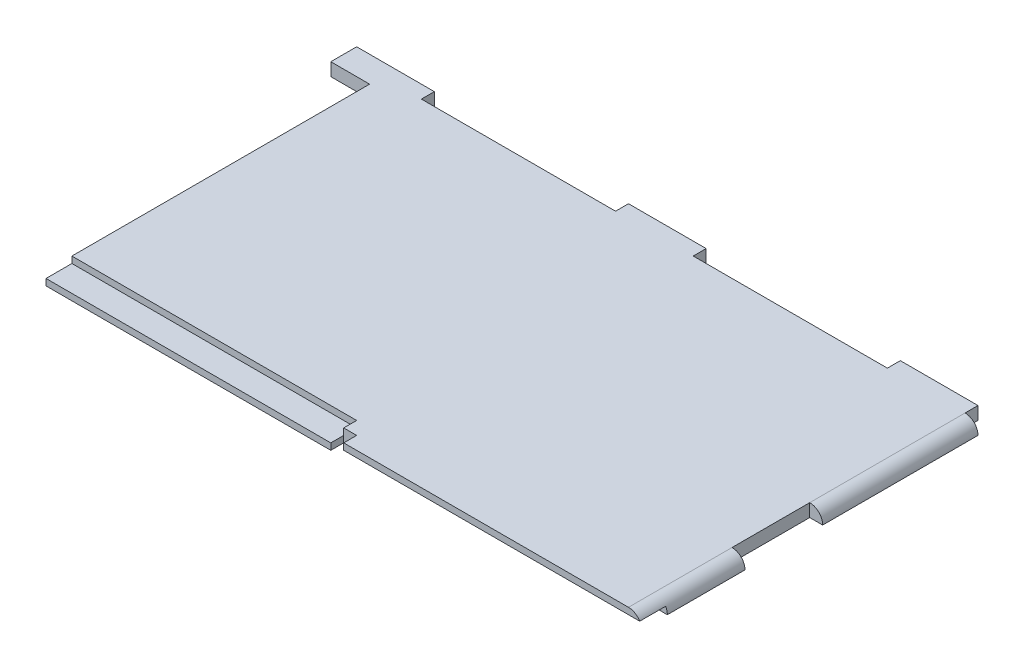
from build123d import *

# Parameters (mm, degrees)
SKETCH_1_W          = 5
SKETCH_1_H          = 60
SKETCH_1_W_2        = 30
SKETCH_1_H_2        = 5
SKETCH_1_W_3        = 15
EXTRUDE_1_DEPTH     = 5
FILLET_1_R          = 5
SKETCH_2_W          = 239.490005879
SKETCH_2_H          = 213.108485662
CUT_EXTRUDE_2_DEPTH = 10
SKETCH_3_W          = 110
SKETCH_3_H          = 2.5
SKETCH_3_W_2        = 115
CUT_EXTRUDE_3_DEPTH = 10
SKETCH_4_W          = 5
SKETCH_4_H          = 5
CUT_EXTRUDE_4_DEPTH = 5


with BuildPart() as part:
    # 草圖1 → 填料-伸長1 (new body)
    with BuildSketch(Plane(origin=(0, 0, 0), x_dir=(1, 0, 0), z_dir=(0, 1, 0))):
        Polygon((198.746286718, -286.464902661), (198.746286718, -256.464902661), (183.246286718, -256.464902661), (183.246286718, -266.464902661), (124.746286718, -266.464902661), (124.746286718, -262.464902661), (109.246286718, -262.464902661), (109.246286718, -266.464902661), (-21.253713282, -266.464902661), (-21.253713282, 38.535097339), (-36.253713282, 38.535097339), (-36.253713282, 43.535097339), (203.746286718, 43.535097339), (203.746286718, -286.464902661), align=None)
        with Locations((206.246286718, -256.464902661)):
            Rectangle(SKETCH_1_W, SKETCH_1_H)
        with Locations((206.246286718, 13.535097339)):
            Rectangle(SKETCH_1_W, SKETCH_1_H)
        with Locations((188.746286718, 46.035097339)):
            Rectangle(SKETCH_1_W_2, SKETCH_1_H_2)
        with Locations((-21.253713282, 46.035097339)):
            Rectangle(SKETCH_1_W_2, SKETCH_1_H_2)
        with Locations((91.246286718, 46.035097339)):
            Rectangle(SKETCH_1_W_3, SKETCH_1_H_2)
        with Locations((76.246286718, 46.035097339)):
            Rectangle(SKETCH_1_W_3, SKETCH_1_H_2)
        with Locations((206.246286718, -166.464902661)):
            Rectangle(SKETCH_1_W, SKETCH_1_H)
        with Locations((206.246286718, -76.464902661)):
            Rectangle(SKETCH_1_W, SKETCH_1_H)
    extrude(amount=EXTRUDE_1_DEPTH)

    # 圓角1
    fillet_1_edges = [part.edges().sort_by_distance(p)[0] for p in [
        (208.746286718, 5, -13.535097339),
        (208.746286718, 5, 76.464902661),
        (208.746286718, 5, 166.464902661),
        (208.746286718, 5, 256.464902661),
    ]]
    fillet(fillet_1_edges, radius=FILLET_1_R - 0.0001)  # a hair under: the kernel refuses the full size

    # 草圖2 → 除料-伸長2 (cut)
    with BuildSketch(Plane(origin=(0, 5, 0), x_dir=(1, 0, 0), z_dir=(0, 1, 0))):
        with Locations((89.001283779, -193.019145492)):
            Rectangle(SKETCH_2_W, SKETCH_2_H)
    extrude(amount=-CUT_EXTRUDE_2_DEPTH, mode=Mode.SUBTRACT)

    # 草圖3 → 除料-伸長3 (cut)
    with BuildSketch(Plane.XY.offset(86.464902661)):
        with Locations((33.746286718, 3.75)):
            Rectangle(SKETCH_3_W, SKETCH_3_H)
        with Locations((151.246286718, 1.25)):
            Rectangle(SKETCH_3_W_2, SKETCH_3_H)
    extrude(amount=-CUT_EXTRUDE_3_DEPTH, mode=Mode.SUBTRACT)

    # 草圖4 → 除料-伸長4 (cut)
    with BuildSketch(Plane.XY.offset(86.464902661)):
        with Locations((91.246286718, 2.5)):
            Rectangle(SKETCH_4_W, SKETCH_4_H)
    extrude(amount=-CUT_EXTRUDE_4_DEPTH, mode=Mode.SUBTRACT)


solid = part.part
